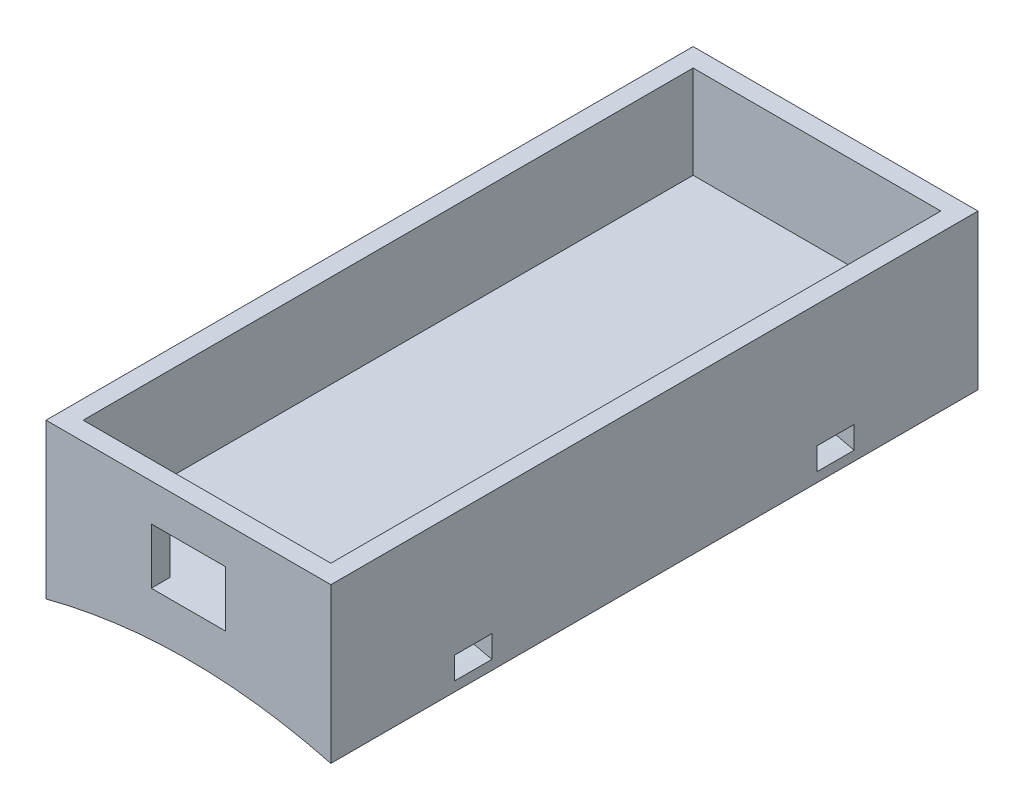
from build123d import *

# Parameters (mm, degrees)
SKETCH2_W           = 23
SKETCH2_H           = 52.25
SKETCH2_W_2         = 20
SKETCH2_H_2         = 49.25
BOSS_EXTRUDE1_DEPTH = 7.5
SKETCH3_W           = 23
SKETCH3_H           = 52.25
BOSS_EXTRUDE2_DEPTH = 5
SKETCH4_W           = 6
SKETCH4_H           = 4.5
CUT_EXTRUDE1_DEPTH  = 1.5
CUT_EXTRUDE2_DEPTH  = 72.5
CUT_EXTRUDE3_START  = -3
CUT_EXTRUDE3_DEPTH  = 3
CUT_EXTRUDE4_DEPTH  = 3


# Read off the part's stored shape, not the designer's step: Cut-Extrude3
with BuildPart() as part:
    # Sketch2 → Boss-Extrude1 (new body)
    with BuildSketch(Plane(origin=(0, 0, 0), x_dir=(1, 0, 0), z_dir=(0, 1, 0))):
        with Locations((10, 25.375)):
            Rectangle(SKETCH2_W, SKETCH2_H)
        with Locations((10, 25.375)):
            Rectangle(SKETCH2_W_2, SKETCH2_H_2, mode=Mode.SUBTRACT)
    extrude(amount=BOSS_EXTRUDE1_DEPTH)

    # Sketch3 → Boss-Extrude2 (add)
    with BuildSketch(Plane.XZ):
        with Locations((10, -25.375)):
            Rectangle(SKETCH3_W, SKETCH3_H)
    extrude(amount=BOSS_EXTRUDE2_DEPTH)

    # Sketch4 → Cut-Extrude1 (cut)
    with BuildSketch(Plane(origin=(0, 0, -0.75), x_dir=(-1, 0, 0), z_dir=(0, 0, -1))):
        with Locations((-10, 2.25)):
            Rectangle(SKETCH4_W, SKETCH4_H)
    extrude(amount=-CUT_EXTRUDE1_DEPTH, mode=Mode.SUBTRACT)

    # Sketch5 → Cut-Extrude2 (cut)
    with BuildSketch(Plane(origin=(0, 0, -51.5), x_dir=(-1, 0, 0), z_dir=(0, 0, -1))):
        with BuildLine():
            Line((1.5, -5), (-21.5, -5))
            add(Edge.make_bspline(
                [(1.5, -5), (-10, -2), (-21.5, -5)],
                knots=[0, 0, 0, 1, 1, 1], degree=2))
        make_face()
    extrude(amount=-CUT_EXTRUDE2_DEPTH, mode=Mode.SUBTRACT)

    # Cut-Extrude3 outline → Cut-Extrude3 (cut)
    with BuildSketch(Plane(origin=(0, 0, -41.5), x_dir=(-1, 0, 0), z_dir=(0, 0, -1)).offset(CUT_EXTRUDE3_START)):
        with BuildLine():
            add(Edge.make_bspline(
                [(1.500000004, -4.225305609), (0.595466246, -3.993211731), (-1.297330219, -3.56483897), (-5.125081209, -2.941229912), (-10, -2.622513392), (-14.874918791, -2.941229912), (-18.702669782, -3.56483897), (-20.595466246, -3.993211731), (-21.500000004, -4.225305609)],
                knots=[0.499397619, 0.499397619, 0.499397619, 0.499397619, 0.499540721, 0.499693814, 0.5, 0.500306186, 0.500459279, 0.500602381, 0.500602381, 0.500602381, 0.500602381], degree=3))
            Line((1.500000004, -4.225305609), (1.5, -2.420629216))
            add(Edge.make_bspline(
                [(1.5, -2.420629216), (0.70515637, -2.224171116), (-1.108540102, -1.822242739), (-4.935012294, -1.198704697), (-10, -0.867469997), (-15.064987706, -1.198704697), (-18.891459898, -1.822242739), (-20.70515637, -2.224171116), (-21.499999999, -2.420629215)],
                knots=[0.499419719, 0.499419719, 0.499419719, 0.499419719, 0.499540721, 0.499693814, 0.5, 0.500306186, 0.500459279, 0.500580281, 0.500580281, 0.500580281, 0.500580281], degree=3))
            Line((-21.499999999, -2.420629215), (-21.500000004, -4.225305609))
        make_face()
    extrude(amount=CUT_EXTRUDE3_DEPTH, mode=Mode.SUBTRACT)

    # Sketch7 → Cut-Extrude4 (cut)
    with BuildSketch(Plane.XY.offset(-9.25)):
        with BuildLine():
            Line((-1.499999999, -2.420629215), (-1.500000004, -4.225305609))
            add(Edge.make_bspline(
                [(-1.500000004, -4.225305609), (-0.595466246, -3.993211731), (1.297330219, -3.56483897), (5.125081209, -2.941229912), (10, -2.622513392), (14.874918791, -2.941229912), (18.702669782, -3.56483897), (20.595466246, -3.993211731), (21.500000004, -4.225305609)],
                knots=[0.499397619, 0.499397619, 0.499397619, 0.499397619, 0.499540721, 0.499693814, 0.5, 0.500306186, 0.500459279, 0.500602381, 0.500602381, 0.500602381, 0.500602381], degree=3))
            Line((21.500000004, -4.225305609), (21.499999999, -2.420629215))
            add(Edge.make_bspline(
                [(21.499999999, -2.420629215), (20.70515637, -2.224171116), (18.891459898, -1.822242739), (15.064987706, -1.198704697), (10, -0.867469997), (4.935012294, -1.198704697), (1.108540102, -1.822242739), (-0.70515637, -2.224171116), (-1.499999999, -2.420629215)],
                knots=[0.499419719, 0.499419719, 0.499419719, 0.499419719, 0.499540721, 0.499693814, 0.5, 0.500306186, 0.500459279, 0.500580281, 0.500580281, 0.500580281, 0.500580281], degree=3))
        make_face()
    extrude(amount=-CUT_EXTRUDE4_DEPTH, mode=Mode.SUBTRACT)


solid = part.part
